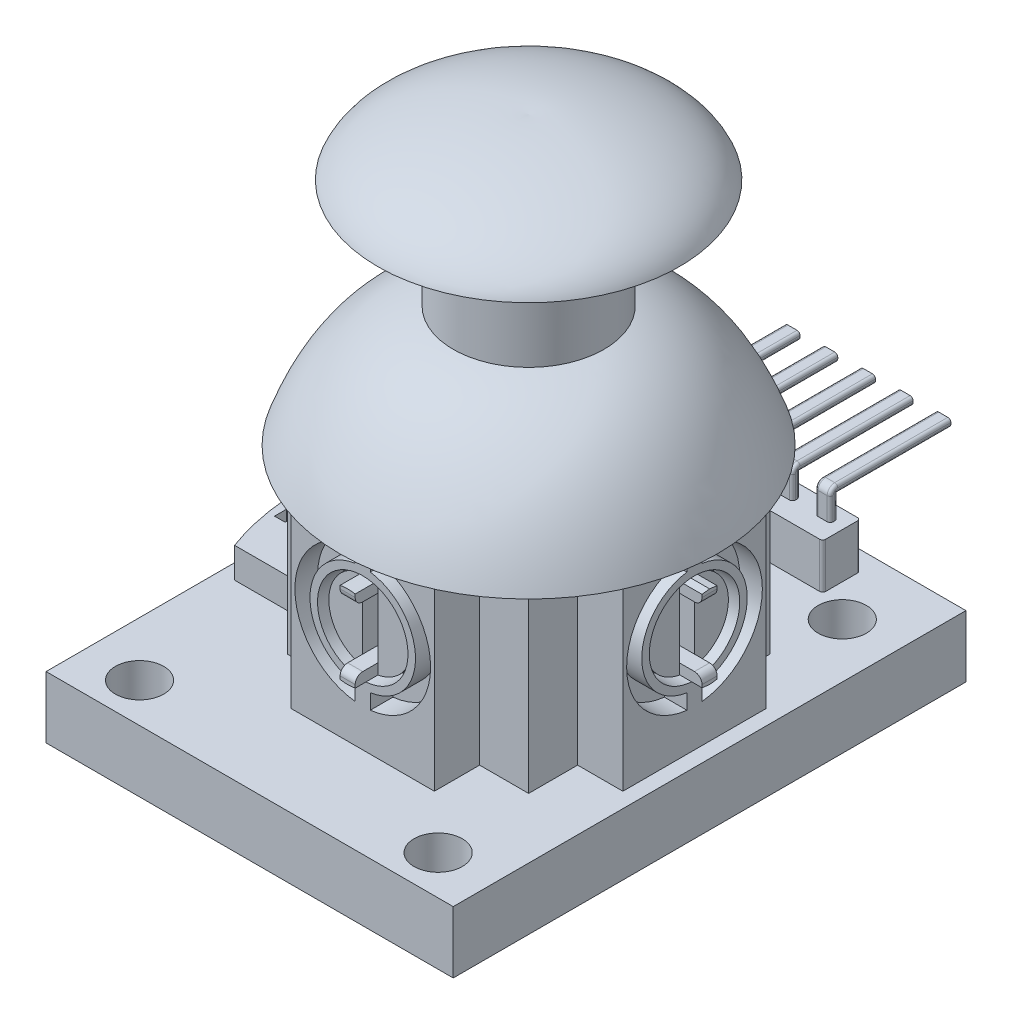
from build123d import *
from build123d.topology import SkipClean

# Parameters (mm, degrees)
IZIM1_W                           = 27
IZIM1_H                           = 34
IZIM1_R                           = 1.6
Y_KSEKLIK_EKSTR_ZYON1_DEPTH       = 1
IZIM2_W                           = 16
IZIM2_H                           = 16
IZIM2_W_2                         = 15.6
IZIM2_H_2                         = 15.6
Y_KSEKLIK_EKSTR_ZYON2_DEPTH       = 12
IZIM3_W                           = 9.5
IZIM3_H                           = 12
Y_KSEKLIK_EKSTR_ZYON3_DEPTH       = 3
IZIM4_R                           = 3
KES_EKSTR_ZYON1_DEPTH             = 1.5
IZIM5_R                           = 2.75
Y_KSEKLIK_EKSTR_ZYON4_DEPTH       = 1
Y_KSEKLIK_EKSTR_ZYON5_DEPTH       = 1.5
RADYUS1_R                         = 0.5
IZIM7_W                           = 1
IZIM7_H                           = 4
KES_EKSTR_ZYON2_DEPTH             = 1.5
IZIM8_W                           = 0.7
IZIM8_H                           = 5
Y_KSEKLIK_EKSTR_ZYON6_DEPTH       = 2
IZIM9_W                           = 5.85
IZIM9_H                           = 4.793448
Y_KSEKLIK_EKSTR_ZYON7_DEPTH       = 1
IZIM10_W                          = 5.65
IZIM10_H                          = 4.793448
Y_KSEKLIK_EKSTR_ZYON8_DEPTH       = 0.2
IZIM11_R                          = 0.15
Y_KSEKLIK_EKSTR_ZYON9_DEPTH       = 0.1
IZIM12_R                          = 1.75
Y_KSEKLIK_EKSTR_ZYON10_DEPTH      = 2
KES_EKSTR_ZYON3_DEPTH             = 2
IZIM14_R                          = 1.5
Y_KSEKLIK_EKSTR_ZYON11_DEPTH      = 31
IZIM15_R                          = 1.4
Y_KSEKLIK_EKSTR_ZYON12_DEPTH      = 8
IZIM17_R                          = 2.15
Y_KSEKLIK_EKSTR_ZYON14_DEPTH      = 2
Y_KSEKLIK_EKSTR_ZYON15_DEPTH      = 1
IZIM22_W                          = 9.5
IZIM22_H                          = 12
Y_KSEKLIK_EKSTR_ZYON16_DEPTH      = 3
KES_EKSTR_ZYON4_DEPTH             = 1.5
IZIM24_R                          = 3
KES_EKSTR_ZYON5_DEPTH             = 1.5
IZIM25_R                          = 2.75
Y_KSEKLIK_EKSTR_ZYON17_DEPTH      = 1
Y_KSEKLIK_EKSTR_ZYON18_DEPTH      = 1.5
RADYUS2_R                         = 0.5
IZIM27_W                          = 1
IZIM27_H                          = 4
KES_EKSTR_ZYON6_DEPTH             = 1.5
Y_KSEKLIK_EKSTR_ZYON19_DEPTH      = 1
Y_KSEKLIK_EKSTR_ZYON20_DEPTH      = 3
Y_KSEKLIK_EKSTR_ZYON21_DEPTH      = 0.5
Y_KSEKLIK_EKSTR_ZYON21_DEPTH_BACK = 0.5
Y_KSEKLIK_EKSTR_ZYON22_DEPTH      = 0.5
Y_KSEKLIK_EKSTR_ZYON22_DEPTH_BACK = 0.5
Y_KSEKLIK_EKSTR_ZYON23_DEPTH      = 0.5
Y_KSEKLIK_EKSTR_ZYON23_DEPTH_BACK = 0.5
Y_KSEKLIK_EKSTR_ZYON24_DEPTH      = 0.5
Y_KSEKLIK_EKSTR_ZYON24_DEPTH_BACK = 0.5
Y_KSEKLIK_EKSTR_ZYON25_DEPTH      = 0.5
Y_KSEKLIK_EKSTR_ZYON25_DEPTH_BACK = 0.5
RADYUS3_R                         = 0.2
BOSS_EXTRUDE1_START               = 3.1
SKETCH1_W                         = 27
SKETCH1_H                         = 34
SKETCH1_R                         = 1.6
BOSS_EXTRUDE1_DEPTH               = 3.1


with BuildPart() as part:
    # Çizim1 → Yükseklik-Ekstrüzyon1 (new body)
    with BuildSketch(Plane(origin=(0, 0, 0), x_dir=(1, 0, 0), z_dir=(0, 1, 0))):
        Rectangle(IZIM1_W, IZIM1_H)
        with Locations(Location((-9.9, -14.4, 0), (0, 0, 270))):
            Circle(IZIM1_R, mode=Mode.SUBTRACT)
        with Locations(Location((9.9, -14.4, 0), (0, 0, 90))):
            Circle(IZIM1_R, mode=Mode.SUBTRACT)
        with Locations(Location((-9.9, 12.4, 0), (0, 0, 270))):
            Circle(IZIM1_R, mode=Mode.SUBTRACT)
        with Locations(Location((9.9, 12.4, 0), (0, 0, 90))):
            Circle(IZIM1_R, mode=Mode.SUBTRACT)
    extrude(amount=Y_KSEKLIK_EKSTR_ZYON1_DEPTH)

    # Çizim2 → Yükseklik-Ekstrüzyon2 (add)
    with BuildSketch(Plane(origin=(0, 1, 0), x_dir=(1, 0, 0), z_dir=(0, 1, 0))):
        with Locations((1.5, 0)):
            Rectangle(IZIM2_W, IZIM2_H)
        with Locations((1.5, 0)):
            Rectangle(IZIM2_W_2, IZIM2_H_2, mode=Mode.SUBTRACT)
    extrude(amount=Y_KSEKLIK_EKSTR_ZYON2_DEPTH)

    # Çizim3 → Yükseklik-Ekstrüzyon3 (add)
    with BuildSketch(Plane.XY.offset(8)):
        with Locations((1.5, 7)):
            Rectangle(IZIM3_W, IZIM3_H)
    extrude(amount=Y_KSEKLIK_EKSTR_ZYON3_DEPTH)

    # Çizim4 → Kes-Ekstrüzyon1 (cut)
    with BuildSketch(Plane.XY.offset(11)):
        with Locations((1.5, 8)):
            Circle(IZIM4_R)
        with BuildLine():
            Line((1, 12.472136), (1, 11.464102))
            ThreePointArc((1, 11.464102), (-2, 8), (1, 4.535898))
            Line((1, 4.535898), (1, 3.527864))
            ThreePointArc((1, 3.527864), (-3, 8), (1, 12.472136))
        make_face()
        with BuildLine():
            Line((2, 12.472136), (2, 11.464102))
            ThreePointArc((2, 11.464102), (5, 8), (2, 4.535898))
            Line((2, 4.535898), (2, 3.527864))
            ThreePointArc((2, 3.527864), (6, 8), (2, 12.472136))
        make_face()
    extrude(amount=-KES_EKSTR_ZYON1_DEPTH, mode=Mode.SUBTRACT)

    # Çizim5 → Yükseklik-Ekstrüzyon4 (add)
    with BuildSketch(Plane.XY.offset(9.5)):
        with Locations((1.5, 8)):
            Circle(IZIM5_R)
    extrude(amount=Y_KSEKLIK_EKSTR_ZYON4_DEPTH)

    # Çizim6 → Yükseklik-Ekstrüzyon5 (add)
    with SkipClean():  # the faces are left unmerged after this step: merging them gives an invalid solid
        with BuildSketch(Plane.XY.offset(10.5)):
            with BuildLine():
                Line((2, 10.704163), (2, 10))
                Line((2, 10), (1, 10))
                Line((1, 10), (1, 10.704163))
                ThreePointArc((1, 10.704163), (1.5, 10.75), (2, 10.704163))
            make_face()
            with BuildLine():
                Line((1, 6), (2, 6))
                Line((2, 6), (2, 5.295837))
                ThreePointArc((2, 5.295837), (1.5, 5.25), (1, 5.295837))
                Line((1, 5.295837), (1, 6))
            make_face()
        extrude(amount=Y_KSEKLIK_EKSTR_ZYON5_DEPTH)

    # Radyus1
    radyus1_edges = [part.edges().sort_by_distance(p)[0] for p in [
        (1.5, 10, 12),
        (1.5, 6, 12),
    ]]
    fillet(radyus1_edges, radius=RADYUS1_R)

    # Çizim7 → Kes-Ekstrüzyon2 (cut)
    with BuildSketch(Plane.XY.offset(10.5)):
        with Locations((1.5, 8)):
            Rectangle(IZIM7_W, IZIM7_H)
    extrude(amount=-KES_EKSTR_ZYON2_DEPTH, mode=Mode.SUBTRACT)

    # Çizim8 → Yükseklik-Ekstrüzyon6 (add)
    with BuildSketch(Plane(origin=(0, 1, 0), x_dir=(1, 0, 0), z_dir=(0, 1, 0))):
        with BuildLine():
            Line((-12.5, 5.5), (-6.5, 5.5))
            Line((-6.5, 5.5), (-6.5, -5.5))
            Line((-6.5, -5.5), (-12.5, -5.5))
            add(Edge.make_bspline(
                [(-12.5, 5.5), (-14.5, 0), (-12.5, -5.5)],
                knots=[0, 0, 0, 1, 1, 1], degree=2))
        make_face()
        with Locations((-12.5, 0)):
            Rectangle(IZIM8_W, IZIM8_H, mode=Mode.SUBTRACT)
    extrude(amount=Y_KSEKLIK_EKSTR_ZYON6_DEPTH)

    # Çizim9 → Yükseklik-Ekstrüzyon7 (add)
    with BuildSketch(Plane(origin=(0, 3, 0), x_dir=(1, 0, 0), z_dir=(0, 1, 0))):
        with Locations((-9.225, 0)):
            Rectangle(IZIM9_W, IZIM9_H)
    extrude(amount=Y_KSEKLIK_EKSTR_ZYON7_DEPTH)

    # Çizim10 → Yükseklik-Ekstrüzyon8 (add)
    with BuildSketch(Plane(origin=(0, 4, 0), x_dir=(1, 0, 0), z_dir=(0, 1, 0))):
        with Locations((-9.325, 0)):
            Rectangle(IZIM10_W, IZIM10_H)
    extrude(amount=Y_KSEKLIK_EKSTR_ZYON8_DEPTH)

    # Çizim11 → Yükseklik-Ekstrüzyon9 (add)
    with BuildSketch(Plane(origin=(0, 4.2, 0), x_dir=(1, 0, 0), z_dir=(0, 1, 0))):
        with Locations(Location((-11.796392, 2.096724, 0), (0, 0, 270))):
            Circle(IZIM11_R)
        with Locations(Location((-6.853608, 2.096724, 0), (0, 0, 90))):
            Circle(IZIM11_R)
        with Locations(Location((-6.853608, -2.096724, 0), (0, 0, 270))):
            Circle(IZIM11_R)
        with Locations(Location((-11.796392, -2.096724, 0), (0, 0, 90))):
            Circle(IZIM11_R)
    extrude(amount=Y_KSEKLIK_EKSTR_ZYON9_DEPTH)

    # Çizim12 → Yükseklik-Ekstrüzyon10 (add)
    with BuildSketch(Plane(origin=(0, 4.2, 0), x_dir=(1, 0, 0), z_dir=(0, 1, 0))):
        with Locations(Location((-9.325, 0, 0), (0, 0, 270))):
            Circle(IZIM12_R)
    extrude(amount=Y_KSEKLIK_EKSTR_ZYON10_DEPTH)

    # Çizim13 → Kes-Ekstrüzyon3 (cut)
    with BuildSketch(Plane.ZY.offset(6.5)):
        with BuildLine():
            Line((-3.5, 6.2), (-1.926136, 6.2))
            ThreePointArc((-1.926136, 6.2), (0, 11.5), (1.926136, 6.2))
            Line((1.926136, 6.2), (3.5, 6.2))
            ThreePointArc((3.5, 6.2), (3.853553, 6.053553), (4, 5.7))
            Line((4, 5.7), (4, 1))
            Line((4, 1), (-4, 1))
            Line((-4, 1), (-4, 5.7))
            ThreePointArc((-4, 5.7), (-3.853553, 6.053553), (-3.5, 6.2))
        make_face()
    extrude(amount=-KES_EKSTR_ZYON3_DEPTH, mode=Mode.SUBTRACT)

    # Çizim14 → Yükseklik-Ekstrüzyon11 (add)
    with BuildSketch(Plane(origin=(0, 1, 0), x_dir=(1, 0, 0), z_dir=(0, 1, 0))):
        with Locations(Location((1.5, 0, 0), (0, 0, 270))):
            Circle(IZIM14_R)
    extrude(amount=Y_KSEKLIK_EKSTR_ZYON11_DEPTH)

    # Çizim15 → Yükseklik-Ekstrüzyon12 (add)
    with BuildSketch(Plane(origin=(1.5, 0, 0), x_dir=(0, 0, -1), z_dir=(1, 0, 0))):
        with Locations((0, 8.5)):
            Circle(IZIM15_R)
    extrude(amount=-Y_KSEKLIK_EKSTR_ZYON12_DEPTH)

    # Çizim17 → Yükseklik-Ekstrüzyon14 (add)
    with SkipClean():  # the faces are left unmerged after this step: merging them gives an invalid solid
        with BuildSketch(Plane.ZY.offset(6.5)):
            with Locations((0, 8.5)):
                Circle(IZIM17_R)
        extrude(amount=Y_KSEKLIK_EKSTR_ZYON14_DEPTH)

    # Çizim18 → Yükseklik-Ekstrüzyon15 (add)
    with SkipClean():  # the faces are left unmerged after this step: merging them gives an invalid solid
        with BuildSketch(Plane.ZY.offset(8.5)):
            with BuildLine():
                Line((1, 8.5), (1, 10.6))
                ThreePointArc((1, 10.6), (0.941421, 10.741421), (0.8, 10.8))
                Line((0.8, 10.8), (-0.8, 10.8))
                ThreePointArc((-0.8, 10.8), (-0.941421, 10.741421), (-1, 10.6))
                Line((-1, 10.6), (-1, 8.5))
                ThreePointArc((-1, 8.5), (0, 7.5), (1, 8.5))
            make_face()
        extrude(amount=Y_KSEKLIK_EKSTR_ZYON15_DEPTH)



with BuildPart() as body_2:
    # Çizim19 → Döndür1 (revolve)
    with BuildSketch(Plane(origin=(1.5, 0, 0), x_dir=(0, 0, -1), z_dir=(1, 0, 0)), mode=Mode.PRIVATE) as d_nd_r1_sk:
        with BuildLine():
            Line((-12.5, 13), (-12.288133, 13))
            add(Edge.make_bspline(
                [(-12.288133, 13), (-12.111507, 13.502279), (-11.702122, 14.536697), (-11.015704, 15.891074), (-10.226286, 17.116712), (-9.058841, 18.530653), (-7.713634, 19.626363), (-6.197298, 20.40463), (-5.366566, 20.692463), (-4.947265, 20.807078)],
                knots=[0.004762, 0.004762, 0.004762, 0.004762, 0.113958, 0.227916, 0.341874, 0.455832, 0.683748, 0.797706, 0.911664, 0.911664, 0.911664, 0.911664], degree=3))
            Line((-4.947265, 20.807078), (-4.8, 20.807078))
            Line((-4.8, 20.807078), (-4.8, 21))
            Line((-4.8, 21), (-4.8, 28.250085))
            Line((-4.8, 28.250085), (-5, 28.250085))
            Line((-5, 28.250085), (-5, 21))
            add(Edge.make_bspline(
                [(-12.5, 13), (-10.213592, 19.574874), (-5, 21)],
                knots=[0, 0, 0, 0.911664, 0.911664, 0.911664], degree=2))
        make_face()
    revolve(d_nd_r1_sk.sketch.rotate(Axis((1.5, 13, 0), (0, 1, 0)), 180), axis=Axis((1.5, 13, 0), (0, 1, 0)))


with BuildPart() as part_1:
    with SkipClean():  # the faces are left unmerged after this step: merging them gives an invalid solid
        add(part.part)

        add(body_2.part)  # Döndür3 merges body 2
        # Çizim21 → Döndür3 (revolve)
        with BuildSketch(Plane(origin=(1.5, 0, 0), x_dir=(0, 0, -1), z_dir=(1, 0, 0)), mode=Mode.PRIVATE) as d_nd_r3_sk:
            with BuildLine():
                Line((0, 32), (0, 31.800503))
                Line((0, 31.800503), (-0.014182, 31.800503))
                add(Edge.make_bspline(
                    [(-0.014182, 31.800503), (-0.21638, 31.814878), (-0.610932, 31.829554), (-1.487447, 31.813408), (-2.658294, 31.705464), (-4.127855, 31.444872), (-5.581424, 31.059598), (-6.945351, 30.557646), (-8.144428, 29.947028), (-8.941287, 29.360532), (-9.424448, 28.847791), (-9.603184, 28.590125), (-9.682203, 28.450085)],
                    knots=[0, 0, 0, 0, 0.047842, 0.095684, 0.191367, 0.287051, 0.382735, 0.478418, 0.574102, 0.669786, 0.717628, 0.765469, 0.765469, 0.765469, 0.765469], degree=3))
                Line((-9.682203, 28.450085), (-4.40609, 28.450085))
                Line((-4.40609, 28.450085), (-4.40609, 28.250085))
                Line((-4.40609, 28.250085), (-10, 28.250085))
                add(Edge.make_bspline(
                    [(0, 32), (-0.745802, 32.053019), (-4.590452, 31.898517), (-9.220348, 30.199043), (-10, 28.250085)],
                    knots=[0, 0, 0, 0, 0.179556, 0.797541, 0.797541, 0.797541, 0.797541], degree=3))
            make_face()
        revolve(d_nd_r3_sk.sketch.rotate(Axis((1.5, 28.250085, 0), (0, 1, 0)), 180), axis=Axis((1.5, 28.250085, 0), (0, 1, 0)))

    # Çizim22 → Yükseklik-Ekstrüzyon16 (add)
    with SkipClean():  # the faces are left unmerged after this step: merging them gives an invalid solid
        with BuildSketch(Plane(origin=(9.5, 0, 0), x_dir=(0, 0, -1), z_dir=(1, 0, 0))):
            with Locations((0, 7)):
                Rectangle(IZIM22_W, IZIM22_H)
        extrude(amount=Y_KSEKLIK_EKSTR_ZYON16_DEPTH)

    # Çizim23 → Kes-Ekstrüzyon4 (cut)
    with SkipClean():  # the faces are left unmerged after this step: merging them gives an invalid solid
        with BuildSketch(Plane(origin=(12.5, 0, 0), x_dir=(0, 0, -1), z_dir=(1, 0, 0))):
            with BuildLine():
                Line((-0.5, 12.472136), (-0.5, 11.464102))
                ThreePointArc((-0.5, 11.464102), (-3.5, 8), (-0.5, 4.535898))
                Line((-0.5, 4.535898), (-0.5, 3.527864))
                ThreePointArc((-0.5, 3.527864), (-4.5, 8), (-0.5, 12.472136))
            make_face()
            with BuildLine():
                Line((0.5, 12.472136), (0.5, 11.464102))
                ThreePointArc((0.5, 11.464102), (3.5, 8), (0.5, 4.535898))
                Line((0.5, 4.535898), (0.5, 3.527864))
                ThreePointArc((0.5, 3.527864), (4.5, 8), (0.5, 12.472136))
            make_face()
        extrude(amount=-KES_EKSTR_ZYON4_DEPTH, mode=Mode.SUBTRACT)

    # Çizim24 → Kes-Ekstrüzyon5 (cut)
    with SkipClean():  # the faces are left unmerged after this step: merging them gives an invalid solid
        with BuildSketch(Plane(origin=(12.5, 0, 0), x_dir=(0, 0, -1), z_dir=(1, 0, 0))):
            with Locations((0, 8)):
                Circle(IZIM24_R)
        extrude(amount=-KES_EKSTR_ZYON5_DEPTH, mode=Mode.SUBTRACT)

    # Çizim25 → Yükseklik-Ekstrüzyon17 (add)
    with SkipClean():  # the faces are left unmerged after this step: merging them gives an invalid solid
        with BuildSketch(Plane(origin=(11, 0, 0), x_dir=(0, 0, -1), z_dir=(1, 0, 0))):
            with Locations((0, 8)):
                Circle(IZIM25_R)
        extrude(amount=Y_KSEKLIK_EKSTR_ZYON17_DEPTH)

    # Çizim26 → Yükseklik-Ekstrüzyon18 (add)
    with SkipClean():  # the faces are left unmerged after this step: merging them gives an invalid solid
        with BuildSketch(Plane(origin=(12, 0, 0), x_dir=(0, 0, -1), z_dir=(1, 0, 0))):
            Polygon((0.5, 10), (-0.5, 10), (-0.5, 10.683557), (0, 10.75), (0.5, 10.683557), align=None)
            Polygon((0.5, 6), (0.5, 5.316705), (0, 5.25), (-0.5, 5.316705), (-0.5, 6), align=None)
        extrude(amount=Y_KSEKLIK_EKSTR_ZYON18_DEPTH)

    # Radyus2
    radyus2_edges = [part_1.edges().sort_by_distance(p)[0] for p in [
        (13.5, 10, 0),
        (13.5, 6, 0),
    ]]
    fillet(radyus2_edges, radius=RADYUS2_R)

    # Çizim27 → Kes-Ekstrüzyon6 (cut)
    with SkipClean():  # the faces are left unmerged after this step: merging them gives an invalid solid
        with BuildSketch(Plane(origin=(12, 0, 0), x_dir=(0, 0, -1), z_dir=(1, 0, 0))):
            with Locations((0, 8)):
                Rectangle(IZIM27_W, IZIM27_H)
        extrude(amount=-KES_EKSTR_ZYON6_DEPTH, mode=Mode.SUBTRACT)

    # Çizim28 → Yükseklik-Ekstrüzyon19 (add)
    with SkipClean():  # the faces are left unmerged after this step: merging them gives an invalid solid
        with BuildSketch(Plane(origin=(0, 0, -8), x_dir=(-1, 0, 0), z_dir=(0, 0, -1))):
            Polygon((-5, 8), (-3.5, 8), (-3.5, 7), (0.5, 7), (0.5, 8), (2, 8), (2.5, 7.5), (2.5, 1), (-5.5, 1), (-5.5, 7.5), align=None)
        extrude(amount=Y_KSEKLIK_EKSTR_ZYON19_DEPTH)

    # Çizim29 → Yükseklik-Ekstrüzyon20 (add)
    with SkipClean():  # the faces are left unmerged after this step: merging them gives an invalid solid
        with BuildSketch(Plane(origin=(0, 1, 0), x_dir=(1, 0, 0), z_dir=(0, 1, 0))):
            with BuildLine():
                Line((-4.55, 15.75), (7.55, 15.75))
                ThreePointArc((7.55, 15.75), (7.691421, 15.691421), (7.75, 15.55))
                Line((7.75, 15.55), (7.75, 13.45))
                ThreePointArc((7.75, 13.45), (7.691421, 13.308579), (7.55, 13.25))
                Line((7.55, 13.25), (-4.55, 13.25))
                ThreePointArc((-4.55, 13.25), (-4.691421, 13.308579), (-4.75, 13.45))
                Line((-4.75, 13.45), (-4.75, 15.55))
                ThreePointArc((-4.75, 15.55), (-4.691421, 15.691421), (-4.55, 15.75))
            make_face()
        extrude(amount=Y_KSEKLIK_EKSTR_ZYON20_DEPTH)

    # Çizim30 → Yükseklik-Ekstrüzyon21 (add, two sides: drawn at the far end of the back side and taken through both)
    with SkipClean():  # the faces are left unmerged after this step: merging them gives an invalid solid
        with BuildSketch(Plane(origin=(1.5, 0, 0), x_dir=(0, 0, -1), z_dir=(1, 0, 0)).offset(-Y_KSEKLIK_EKSTR_ZYON21_DEPTH_BACK)):
            with BuildLine():
                Line((14.5, 4), (14.5, 5.5))
                ThreePointArc((14.5, 5.5), (14.646447, 5.853553), (15, 6))
                Line((15, 6), (22.5, 6))
                Line((22.5, 6), (22.5, 5.5))
                Line((22.5, 5.5), (15, 5.5))
                Line((15, 5.5), (15, 4))
                Line((15, 4), (14.5, 4))
            make_face()
        extrude(amount=Y_KSEKLIK_EKSTR_ZYON21_DEPTH + Y_KSEKLIK_EKSTR_ZYON21_DEPTH_BACK)

    # Çizim31 → Yükseklik-Ekstrüzyon22 (add, two sides: drawn at the far end of the back side and taken through both)
    with SkipClean():  # the faces are left unmerged after this step: merging them gives an invalid solid
        with BuildSketch(Plane(origin=(4, 0, 0), x_dir=(0, 0, -1), z_dir=(1, 0, 0)).offset(-Y_KSEKLIK_EKSTR_ZYON22_DEPTH_BACK)):
            with BuildLine():
                Line((14.5, 4), (14.5, 5.5))
                ThreePointArc((14.5, 5.5), (14.646447, 5.853553), (15, 6))
                Line((15, 6), (22.5, 6))
                Line((22.5, 6), (22.5, 5.5))
                Line((22.5, 5.5), (15, 5.5))
                Line((15, 5.5), (15, 4))
                Line((15, 4), (14.5, 4))
            make_face()
        extrude(amount=Y_KSEKLIK_EKSTR_ZYON22_DEPTH + Y_KSEKLIK_EKSTR_ZYON22_DEPTH_BACK)

    # Çizim33 → Yükseklik-Ekstrüzyon23 (add, two sides: drawn at the far end of the back side and taken through both)
    with SkipClean():  # the faces are left unmerged after this step: merging them gives an invalid solid
        with BuildSketch(Plane(origin=(6.5, 0, 0), x_dir=(0, 0, -1), z_dir=(1, 0, 0)).offset(-Y_KSEKLIK_EKSTR_ZYON23_DEPTH_BACK)):
            with BuildLine():
                Line((14.5, 4), (14.5, 5.5))
                ThreePointArc((14.5, 5.5), (14.646447, 5.853553), (15, 6))
                Line((15, 6), (22.5, 6))
                Line((22.5, 6), (22.5, 5.5))
                Line((22.5, 5.5), (15, 5.5))
                Line((15, 5.5), (15, 4))
                Line((15, 4), (14.5, 4))
            make_face()
        extrude(amount=Y_KSEKLIK_EKSTR_ZYON23_DEPTH + Y_KSEKLIK_EKSTR_ZYON23_DEPTH_BACK)

    # Çizim34 → Yükseklik-Ekstrüzyon24 (add, two sides: drawn at the far end of the back side and taken through both)
    with SkipClean():  # the faces are left unmerged after this step: merging them gives an invalid solid
        with BuildSketch(Plane(origin=(-1, 0, 0), x_dir=(0, 0, -1), z_dir=(1, 0, 0)).offset(-Y_KSEKLIK_EKSTR_ZYON24_DEPTH_BACK)):
            with BuildLine():
                Line((14.5, 4), (14.5, 5.5))
                ThreePointArc((14.5, 5.5), (14.646447, 5.853553), (15, 6))
                Line((15, 6), (22.5, 6))
                Line((22.5, 6), (22.5, 5.5))
                Line((22.5, 5.5), (15, 5.5))
                Line((15, 5.5), (15, 4))
                Line((15, 4), (14.5, 4))
            make_face()
        extrude(amount=Y_KSEKLIK_EKSTR_ZYON24_DEPTH + Y_KSEKLIK_EKSTR_ZYON24_DEPTH_BACK)

    # Çizim35 → Yükseklik-Ekstrüzyon25 (add, two sides: drawn at the far end of the back side and taken through both)
    with SkipClean():  # the faces are left unmerged after this step: merging them gives an invalid solid
        with BuildSketch(Plane(origin=(-3.5, 0, 0), x_dir=(0, 0, -1), z_dir=(1, 0, 0)).offset(-Y_KSEKLIK_EKSTR_ZYON25_DEPTH_BACK)):
            with BuildLine():
                Line((14.5, 4), (14.5, 5.5))
                ThreePointArc((14.5, 5.5), (14.646447, 5.853553), (15, 6))
                Line((15, 6), (22.5, 6))
                Line((22.5, 6), (22.5, 5.5))
                Line((22.5, 5.5), (15, 5.5))
                Line((15, 5.5), (15, 4))
                Line((15, 4), (14.5, 4))
            make_face()
        extrude(amount=Y_KSEKLIK_EKSTR_ZYON25_DEPTH + Y_KSEKLIK_EKSTR_ZYON25_DEPTH_BACK)

    # Radyus3
    radyus3_edges = [part_1.edges().sort_by_distance(p)[0] for p in [
        (1, 4.75, -14.5),
        (1, 5.853553, -14.646447),
        (1, 6, -18.75),
        (1, 5.5, -18.75),
        (1, 4.75, -15),
        (2, 4.75, -15),
        (2, 5.5, -18.75),
        (2, 6, -18.75),
        (2, 5.853553, -14.646447),
        (2, 4.75, -14.5),
        (3.5, 4.75, -14.5),
        (3.5, 5.853553, -14.646447),
        (3.5, 6, -18.75),
        (3.5, 5.5, -18.75),
        (3.5, 4.75, -15),
        (4.5, 4.75, -15),
        (4.5, 5.5, -18.75),
        (4.5, 6, -18.75),
        (4.5, 5.853553, -14.646447),
        (4.5, 4.75, -14.5),
        (6, 4.75, -14.5),
        (6, 5.853553, -14.646447),
        (6, 6, -18.75),
        (6, 5.5, -18.75),
        (6, 4.75, -15),
        (7, 4.75, -15),
        (7, 5.5, -18.75),
        (7, 6, -18.75),
        (7, 5.853553, -14.646447),
        (7, 4.75, -14.5),
        (-1.5, 4.75, -14.5),
        (-1.5, 5.853553, -14.646447),
        (-1.5, 6, -18.75),
        (-1.5, 5.5, -18.75),
        (-1.5, 4.75, -15),
        (-0.5, 4.75, -15),
        (-0.5, 5.5, -18.75),
        (-0.5, 6, -18.75),
        (-0.5, 5.853553, -14.646447),
        (-0.5, 4.75, -14.5),
        (-4, 4.75, -14.5),
        (-4, 5.853553, -14.646447),
        (-4, 6, -18.75),
        (-4, 5.5, -18.75),
        (-4, 4.75, -15),
        (-3, 4.75, -15),
        (-3, 5.5, -18.75),
        (-3, 6, -18.75),
        (-3, 5.853553, -14.646447),
        (-3, 4.75, -14.5),
    ]]
    fillet(radyus3_edges, radius=RADYUS3_R)

    # Sketch1 → Boss-Extrude1 (add)
    with BuildSketch(Plane.XZ.offset(BOSS_EXTRUDE1_START)):
        Rectangle(SKETCH1_W, SKETCH1_H)
        with Locations(Location((-9.9, 14.4, 0), (0, 0, 270))):
            Circle(SKETCH1_R, mode=Mode.SUBTRACT)
        with Locations(Location((9.9, 14.4, 0), (0, 0, 270))):
            Circle(SKETCH1_R, mode=Mode.SUBTRACT)
        with Locations(Location((9.9, -12.4, 0), (0, 0, 270))):
            Circle(SKETCH1_R, mode=Mode.SUBTRACT)
        with Locations(Location((-9.9, -12.4, 0), (0, 0, 270))):
            Circle(SKETCH1_R, mode=Mode.SUBTRACT)
    extrude(amount=-BOSS_EXTRUDE1_DEPTH)


solid = part_1.part
